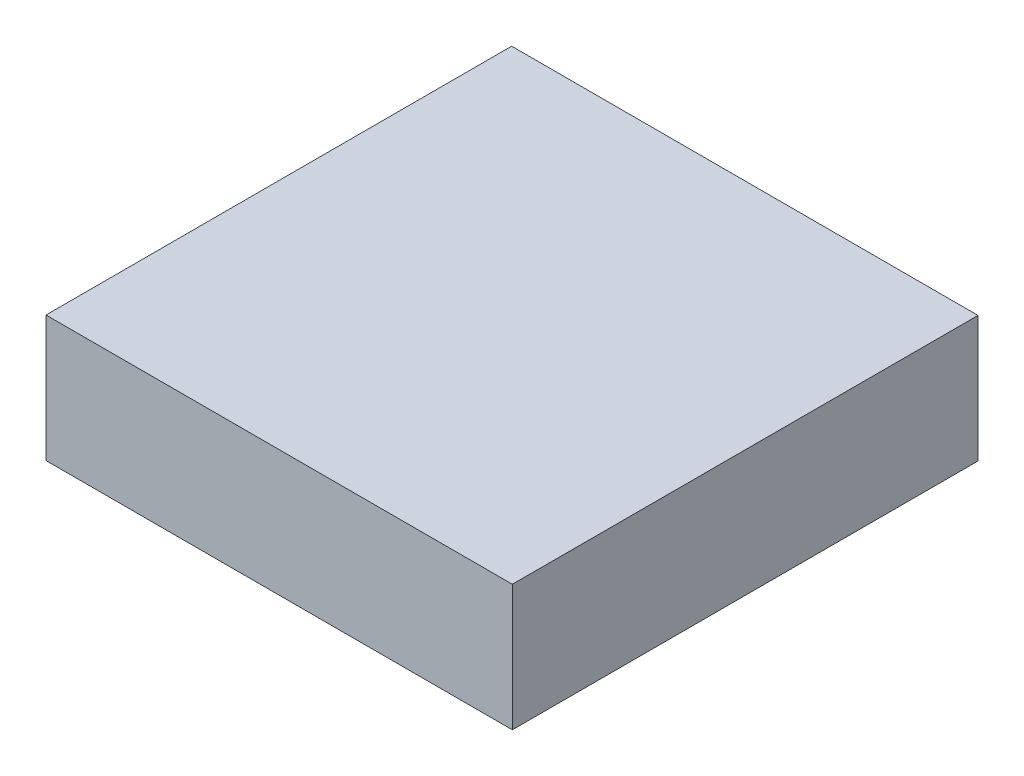
from build123d import *

# Parameters (mm, degrees)
SKETCH1_R                    = 11
SKETCH1_R_2                  = 16
BOSS_EXTRUDE1_DEPTH          = 3.5
FILLET1_R                    = 3.5
FILLET2_R                    = 0.5
FILLET3_R                    = 0.5
SALIENTE_EXTRUIR1_DEPTH      = 8
SALIENTE_EXTRUIR1_DEPTH_BACK = 2.5
CROQUIS1_W                   = 101.720670144
CROQUIS1_H                   = 101.56591671
CROQUIS2_W                   = 101.720670144
CROQUIS2_H                   = 101.56591671
CROQUIS2_W_2                 = 90.330003626
CROQUIS2_H_2                 = 92.036037492
SALIENTE_EXTRUIR2_DEPTH      = 17


with BuildPart() as part:
    # Sketch1 → Boss-Extrude1 (new, symmetric)
    # profile 1 of 4: a face of its own
    with BuildSketch(Plane(origin=(0, 0, 0), x_dir=(1, 0, 0), z_dir=(0, 1, 0))):
        with BuildLine():
            ThreePointArc((14.824999698, 23.981745772), (0.02872042, 14.000025777), (-14.803298349, 23.928562115))
            ThreePointArc((-14.803298349, 23.928562115), (-15.677567726, 10.759919254), (-26.618385425, 3.379132725))
            ThreePointArc((-26.618385425, 3.379132725), (-13.910911314, -0.402159626), (-8.417846624, -12.468820739))
            ThreePointArc((-8.417846624, -12.468820739), (-9.275939578, -17.638216355), (-11.758178003, -22.253134226))
            ThreePointArc((-11.758178003, -22.253134226), (0.083335936, -16.425952286), (11.94569342, -22.210585087))
            ThreePointArc((11.94569342, -22.210585087), (10.69940997, -4.405771353), (26.713784045, 3.474865521))
            ThreePointArc((26.713784045, 3.474865521), (15.746539483, 10.816326442), (14.824999698, 23.981745772))
        make_face()
        with Locations(Location((0, 0, 0), (0, 0, 270))):
            Circle(SKETCH1_R, mode=Mode.SUBTRACT)
    # profile 2 of 4: a face of its own
    with BuildSketch(Plane(origin=(0, 0, 0), x_dir=(1, 0, 0), z_dir=(0, 1, 0))):
        with Locations((-24.417846624, -12.468820739)):
            Circle(SKETCH1_R_2)
        with Locations(Location((-24.417846624, -12.468820739, 0), (0, 0, 270))):
            Circle(SKETCH1_R, mode=Mode.SUBTRACT)
    # profile 3 of 4: a face of its own
    with BuildSketch(Plane(origin=(0, 0, 0), x_dir=(1, 0, 0), z_dir=(0, 1, 0))):
        with Locations((24.570154317, -12.380885851)):
            Circle(SKETCH1_R_2)
        with Locations(Location((24.570154317, -12.380885851, 0), (0, 0, 270))):
            Circle(SKETCH1_R, mode=Mode.SUBTRACT)
    # profile 4 of 4: a face of its own
    with BuildSketch(Plane(origin=(0, 0, 0), x_dir=(1, 0, 0), z_dir=(0, 1, 0))):
        with Locations((0, 30)):
            Circle(SKETCH1_R_2)
        with Locations(Location((0, 30, 0), (0, 0, 270))):
            Circle(SKETCH1_R, mode=Mode.SUBTRACT)
    extrude(amount=BOSS_EXTRUDE1_DEPTH, both=True)

    # Fillet1
    fillet1_edges = [part.edges().sort_by_distance(p)[0] for p in [
        (-0.02872042, -3.5, -45.999974223),
        (-15.677567726, 3.5, -10.759919254),
        (15.746539483, -3.5, -10.816326442),
        (38.440898664, -3.5, 20.35600035),
        (0.083335936, -3.5, 16.425952286),
        (-38.259870551, -3.5, 20.493680463),
    ]]
    fillet(fillet1_edges, radius=FILLET1_R - 0.0001)  # a hair under: the kernel refuses the full size

    # Fillet2
    fillet2_edges = [part.edges().sort_by_distance(p)[0] for p in [
        (-24.417846624, -3.5, 1.468820739),
        (24.570154317, -3.5, 1.380885851),
        (0, -3.5, -41),
        (0, 3.5, -41),
        (24.570154317, 3.5, 1.380885851),
        (-24.417846624, 3.5, 1.468820739),
    ]]
    fillet(fillet2_edges, radius=FILLET2_R)

    # Fillet3
    fillet3_edges = [part.edges().sort_by_distance(p)[0] for p in [
        (0, -3.5, -11),
        (0, 3.5, -11),
    ]]
    fillet(fillet3_edges, radius=FILLET3_R)

    # Croquis1 → Saliente-Extruir1 (add, two sides: drawn at the far end of the back side and taken through both)
    with BuildSketch(Plane(origin=(0, 3.5, 0), x_dir=(1, 0, 0), z_dir=(0, 1, 0)).offset(-SALIENTE_EXTRUIR1_DEPTH_BACK)):
        Rectangle(CROQUIS1_W, CROQUIS1_H)
    extrude(amount=SALIENTE_EXTRUIR1_DEPTH + SALIENTE_EXTRUIR1_DEPTH_BACK)

    # Croquis2 → Saliente-Extruir2 (add)
    with BuildSketch(Plane.XZ.offset(-1)):
        Rectangle(CROQUIS2_W, CROQUIS2_H)
        Rectangle(CROQUIS2_W_2, CROQUIS2_H_2, mode=Mode.SUBTRACT)
    extrude(amount=SALIENTE_EXTRUIR2_DEPTH)


solid = part.part
